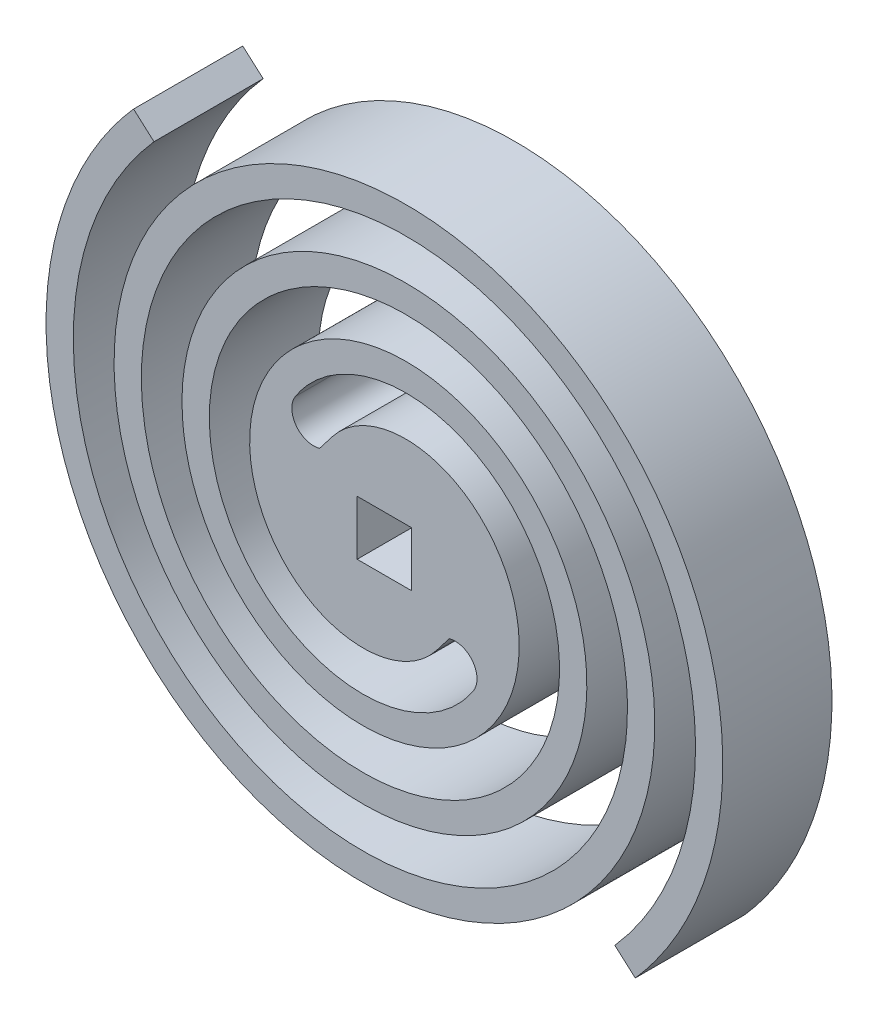
from build123d import *

# Parameters (mm, degrees)
BOSS_EXTRUDE1_DEPTH = 12.7
FILLET1_DEPTH       = 12.7
CUT_EXTRUDE2_REACH  = 56.455
SKETCH6_W           = 6.35
SKETCH6_H           = 6.35


with BuildPart() as part:
    # Sketch5 → Boss-Extrude1 (new body)
    with BuildSketch(Plane.XY):
        with BuildLine():
            Line((-7.544575, 5.814207863), (-6.053628459, 7.748875192))
            add(Edge.make_bspline(
                [(-6.053628459, 7.748875192), (-5.494603872, 8.474271157), (-4.81378454, 9.143172779), (-2.87941615, 10.549007168), (-1.506573664, 11.178645833), (1.506573664, 11.840104167), (3.145692963, 11.870626383), (5.60336479, 11.389593386), (6.421912552, 11.142281181), (8.020309271, 10.472031225), (8.800100547, 10.049082873), (10.28294371, 9.033961384), (10.98593582, 8.441790238), (12.278324098, 7.102891267), (12.867661134, 6.356178392), (13.898861197, 4.730878175), (14.340668532, 3.852318514), (15.047642909, 1.993380088), (15.312760417, 1.013040912), (15.643489583, -1.013040912), (15.709060383, -2.058733463), (15.625496849, -4.174097497), (15.476332528, -5.243710299), (14.956836698, -7.36212114), (14.58648784, -8.41085429), (13.627614614, -10.441206258), (13.039086783, -11.422756714), (11.65661755, -13.272947619), (10.862687224, -14.141519209), (9.091833005, -15.722530756), (8.114934742, -16.434904446), (6.009671569, -17.664911675), (4.881346208, -18.182484606), (2.512881825, -18.990809998), (1.272794992, -19.281510417), (-1.272794992, -19.612239583), (-2.5782352, -19.652227472), (-5.203125191, -19.467312923), (-6.522503693, -19.242383006), (-9.12087749, -18.524080009), (-10.399796028, -18.030694498), (-12.862103244, -16.783198003), (-14.04541288, -16.029090692), (-16.262951528, -14.279273717), (-17.297102598, -13.283584211), (-19.166737415, -11.080774743), (-20.002147757, -9.873691093), (-21.430962152, -7.288464963), (-22.024300681, -5.910373902), (-22.933977087, -3.032383562), (-23.250260417, -1.532549072), (-23.580989583, 1.532549072), (-23.59539456, 3.097736937), (-23.309128998, 6.232152885), (-23.008433483, 7.801297088), (-22.091323321, 10.879633841), (-21.474901157, 12.388737766), (-19.938781392, 15.283000231), (-19.019094601, 16.668069047), (-16.901929883, 19.252955438), (-15.704481197, 20.452685987), (-13.069716481, 22.610944074), (-11.632447443, 23.569391069), (-8.567258357, 25.19701263), (-6.939401595, 25.866116755), (-3.5518853, 26.877144175), (-1.792303153, 27.219010417), (1.792303153, 27.549739583), (3.617238674, 27.538561649), (7.261180579, 27.150945072), (9.080090482, 26.774483961), (12.638390191, 25.658566633), (14.377679504, 24.919107816), (17.703897217, 23.094364781), (19.290725213, 22.009098511), (22.242959347, 19.524586049), (23.608269376, 18.125378184), (26.055150732, 15.058658219), (27.136634381, 13.391203793), (28.963063108, 9.846051751), (29.70793283, 7.968429289), (30.820311264, 4.071387037), (31.187760417, 2.052057233), (31.518489583, -2.052057233), (31.481728738, -4.136740411), (30.992761147, -8.290208272), (30.540534438, -10.358883876), (29.225809944, -14.397146541), (28.363314474, -16.366621242), (26.24994817, -20.124794204), (24.99910242, -21.913381379), (22.147242216, -25.232963256), (20.54627517, -26.763852765), (17.047599957, -29.499357391), (15.149960144, -30.703877692), (11.124845146, -32.729113585), (8.997456983, -33.549748904), (4.590888774, -34.763478353), (2.311811313, -35.156510417), (-2.311811313, -35.487239583), (-4.656242149, -35.424895827), (-9.319235966, -34.834577221), (-11.63767727, -34.306584916), (-16.155902891, -32.793053256), (-18.35556298, -31.807521133), (-22.54569119, -29.405531559), (-24.536037546, -27.989106329), (-28.222967166, -24.769898382), (-29.919436154, -22.967172157), (-32.943564049, -19.036541695), (-34.271121004, -16.908716494), (-36.495164063, -12.40363854), (-37.391564979, -10.026484677), (-38.706645442, -5.110390511), (-39.125260417, -2.571565393), (-39.455989583, 2.571565393), (-39.368062915, 5.175743886), (-38.676393296, 10.34826366), (-38.072635394, 12.916470664), (-36.360296568, 17.914659242), (-35.251727791, 20.344504718), (-32.561114948, 24.966588177), (-30.979110238, 27.158693712), (-29.185832393, 29.185832393)],
                knots=[0.009721649, 0.009721649, 0.009721649, 0.009721649, 0.03125, 0.03125, 0.0625, 0.0625, 0.09375, 0.09375, 0.109375, 0.109375, 0.125, 0.125, 0.140625, 0.140625, 0.15625, 0.15625, 0.171875, 0.171875, 0.1875, 0.1875, 0.203125, 0.203125, 0.21875, 0.21875, 0.234375, 0.234375, 0.25, 0.25, 0.265625, 0.265625, 0.28125, 0.28125, 0.296875, 0.296875, 0.3125, 0.3125, 0.328125, 0.328125, 0.34375, 0.34375, 0.359375, 0.359375, 0.375, 0.375, 0.390625, 0.390625, 0.40625, 0.40625, 0.421875, 0.421875, 0.4375, 0.4375, 0.453125, 0.453125, 0.46875, 0.46875, 0.484375, 0.484375, 0.5, 0.5, 0.515625, 0.515625, 0.53125, 0.53125, 0.546875, 0.546875, 0.5625, 0.5625, 0.578125, 0.578125, 0.59375, 0.59375, 0.609375, 0.609375, 0.625, 0.625, 0.640625, 0.640625, 0.65625, 0.65625, 0.671875, 0.671875, 0.6875, 0.6875, 0.703125, 0.703125, 0.71875, 0.71875, 0.734375, 0.734375, 0.75, 0.75, 0.765625, 0.765625, 0.78125, 0.78125, 0.796875, 0.796875, 0.8125, 0.8125, 0.828125, 0.828125, 0.84375, 0.84375, 0.859375, 0.859375, 0.875, 0.875, 0.890625, 0.890625, 0.90625, 0.90625, 0.921875, 0.921875, 0.9375, 0.9375, 0.953125, 0.953125, 0.96875, 0.96875, 0.984375, 0.984375, 1, 1, 1, 1], degree=3))
            Line((-29.185832393, 29.185832393), (-26.807791467, 27.082134138))
            add(Edge.make_bspline(
                [(4.601695641, 8.339665594), (5.067405868, 8.225077862), (5.534113419, 8.071718691), (6.593192013, 7.627619067), (7.184489663, 7.307383565), (8.311501092, 6.535856576), (8.850953576, 6.081968761), (9.844524359, 5.05264118), (10.301756809, 4.473931069), (11.102914847, 3.211205843), (11.449216067, 2.523388912), (12.003832404, 1.065065027), (12.213701403, 0.290385126), (12.475495439, -1.313392807), (12.528102661, -2.146863055), (12.461403362, -3.835318421), (12.341891986, -4.69469826), (11.924011349, -6.398740562), (11.624569498, -7.247645298), (10.84765878, -8.892703439), (10.368302315, -9.692780107), (9.240582183, -11.202034333), (8.589599617, -11.914664171), (7.135881658, -13.212537736), (6.32990717, -13.800630961), (4.59135496, -14.816386052), (3.655051891, -15.246187791), (1.6881638, -15.917460536), (0.653518602, -16.160283699), (-1.471649795, -16.436390683), (-2.566405083, -16.470192292), (-4.768725351, -16.31504634), (-5.880526276, -16.125768451), (-8.070900266, -15.520254262), (-9.153546431, -15.102858897), (-11.238509111, -14.046539191), (-12.244576927, -13.405678502), (-14.130253158, -11.917727759), (-15.013145914, -11.068005365), (-16.609394724, -9.187300127), (-17.325442262, -8.153096699), (-18.5500084, -5.937427269), (-19.060523695, -4.752282292), (-19.843010218, -2.27668917), (-20.116209143, -0.982250454), (-20.401686956, 1.663471797), (-20.414380716, 3.01889954), (-20.166461403, 5.73344976), (-19.905438423, 7.096707125), (-19.108655184, 9.771159148), (-18.571680414, 11.086317745), (-17.233047743, 13.608487162), (-16.42942206, 14.819136901), (-14.579077094, 17.078258018), (-13.529717083, 18.129902678), (-11.220582937, 20.021421648), (-9.957601183, 20.863881804), (-7.264053684, 22.294160936), (-5.829840973, 22.883879944), (-2.845403139, 23.774605838), (-1.291235704, 24.076755661), (1.874632573, 24.368850493), (3.490416266, 24.359139779), (6.716324625, 24.015990633), (8.330513096, 23.682087438), (11.487796789, 22.691932625), (13.034778603, 22.034428265), (15.992625565, 20.41177121), (17.40704944, 19.444629341), (20.037894141, 17.23058867), (21.257408492, 15.981044175), (23.442371081, 13.242591663), (24.410328871, 11.750486499), (26.044469825, 8.578570697), (26.712482872, 6.895137525), (27.709644714, 3.401738416), (28.039874717, 1.587866668), (28.336893559, -2.097926569), (28.303975181, -3.973884546), (27.864065527, -7.710636517), (27.456569546, -9.575440522), (26.27171541, -13.21479785), (25.493076927, -14.993179084), (23.585299744, -18.385755475), (22.454156937, -20.003448365), (19.875574607, -23.004933206), (18.425486916, -24.391757875), (15.257126895, -26.868999391), (13.535666759, -27.961867509), (9.885047433, -29.798675971), (7.952285815, -30.544392555), (3.949832389, -31.646814068), (1.876264247, -32.004553018), (-2.329324144, -32.305380066), (-4.465343701, -32.248721692), (-8.712612173, -31.711032452), (-10.827828081, -31.229466652), (-14.948764913, -29.849020237), (-16.958266879, -28.948838786), (-20.784945103, -26.755196794), (-22.605570402, -25.459721652), (-25.976969681, -22.516016057), (-27.530727858, -20.865136854), (-30.299460269, -17.26645838), (-31.516839312, -15.31548016), (-33.555499835, -11.185917766), (-34.378514869, -9.003748649), (-35.585386094, -4.492167223), (-35.970238888, -2.158903595), (-36.274099593, 2.566398865), (-36.193330097, 4.962405792), (-35.557148264, 9.719970701), (-35.001177459, 12.085459775), (-33.424509041, 16.687636609), (-32.402495051, 18.928066447), (-29.922458757, 23.18840987), (-28.462431463, 25.211713026), (-26.807791467, 27.082134138)],
                knots=[0.097413737, 0.097413737, 0.097413737, 0.097413737, 0.109375, 0.109375, 0.125, 0.125, 0.140625, 0.140625, 0.15625, 0.15625, 0.171875, 0.171875, 0.1875, 0.1875, 0.203125, 0.203125, 0.21875, 0.21875, 0.234375, 0.234375, 0.25, 0.25, 0.265625, 0.265625, 0.28125, 0.28125, 0.296875, 0.296875, 0.3125, 0.3125, 0.328125, 0.328125, 0.34375, 0.34375, 0.359375, 0.359375, 0.375, 0.375, 0.390625, 0.390625, 0.40625, 0.40625, 0.421875, 0.421875, 0.4375, 0.4375, 0.453125, 0.453125, 0.46875, 0.46875, 0.484375, 0.484375, 0.5, 0.5, 0.515625, 0.515625, 0.53125, 0.53125, 0.546875, 0.546875, 0.5625, 0.5625, 0.578125, 0.578125, 0.59375, 0.59375, 0.609375, 0.609375, 0.625, 0.625, 0.640625, 0.640625, 0.65625, 0.65625, 0.671875, 0.671875, 0.6875, 0.6875, 0.703125, 0.703125, 0.71875, 0.71875, 0.734375, 0.734375, 0.75, 0.75, 0.765625, 0.765625, 0.78125, 0.78125, 0.796875, 0.796875, 0.8125, 0.8125, 0.828125, 0.828125, 0.84375, 0.84375, 0.859375, 0.859375, 0.875, 0.875, 0.890625, 0.890625, 0.90625, 0.90625, 0.921875, 0.921875, 0.9375, 0.9375, 0.953125, 0.953125, 0.96875, 0.96875, 0.984375, 0.984375, 1, 1, 1, 1], degree=3))
            ThreePointArc((4.601695641, 8.339665594), (9.32555661, 1.938973676), (7.544575, -5.814207863))
            Line((7.544575, -5.814207863), (6.053628459, -7.748875192))
            add(Edge.make_bspline(
                [(6.053628459, -7.748875192), (5.494603872, -8.474271157), (4.81378454, -9.143172779), (2.87941615, -10.549007168), (1.506573664, -11.178645833), (-1.506573664, -11.840104167), (-3.145692963, -11.870626383), (-5.60336479, -11.389593386), (-6.421912552, -11.142281181), (-8.020309271, -10.472031225), (-8.800100547, -10.049082873), (-10.28294371, -9.033961384), (-10.98593582, -8.441790238), (-12.278324098, -7.102891267), (-12.867661134, -6.356178392), (-13.898861197, -4.730878175), (-14.340668532, -3.852318514), (-15.047642909, -1.993380088), (-15.312760417, -1.013040912), (-15.643489583, 1.013040912), (-15.709060383, 2.058733463), (-15.625496849, 4.174097497), (-15.476332528, 5.243710299), (-14.956836698, 7.36212114), (-14.58648784, 8.41085429), (-13.627614614, 10.441206258), (-13.039086783, 11.422756714), (-11.65661755, 13.272947619), (-10.862687224, 14.141519209), (-9.091833005, 15.722530756), (-8.114934742, 16.434904446), (-6.009671569, 17.664911675), (-4.881346208, 18.182484606), (-2.512881825, 18.990809998), (-1.272794992, 19.281510417), (1.272794992, 19.612239583), (2.5782352, 19.652227472), (5.203125191, 19.467312923), (6.522503693, 19.242383006), (9.12087749, 18.524080009), (10.399796028, 18.030694498), (12.862103244, 16.783198003), (14.04541288, 16.029090692), (16.262951528, 14.279273717), (17.297102598, 13.283584211), (19.166737415, 11.080774743), (20.002147757, 9.873691093), (21.430962152, 7.288464963), (22.024300681, 5.910373902), (22.933977087, 3.032383562), (23.250260417, 1.532549072), (23.580989583, -1.532549072), (23.59539456, -3.097736937), (23.309128998, -6.232152885), (23.008433483, -7.801297088), (22.091323321, -10.879633841), (21.474901157, -12.388737766), (19.938781392, -15.283000231), (19.019094601, -16.668069047), (16.901929883, -19.252955438), (15.704481197, -20.452685987), (13.069716481, -22.610944074), (11.632447443, -23.569391069), (8.567258357, -25.19701263), (6.939401595, -25.866116755), (3.5518853, -26.877144175), (1.792303153, -27.219010417), (-1.792303153, -27.549739583), (-3.617238674, -27.538561649), (-7.261180579, -27.150945072), (-9.080090482, -26.774483961), (-12.638390191, -25.658566633), (-14.377679504, -24.919107816), (-17.703897217, -23.094364781), (-19.290725213, -22.009098511), (-22.242959347, -19.524586049), (-23.608269376, -18.125378184), (-26.055150732, -15.058658219), (-27.136634381, -13.391203793), (-28.963063108, -9.846051751), (-29.70793283, -7.968429289), (-30.820311264, -4.071387037), (-31.187760417, -2.052057233), (-31.518489583, 2.052057233), (-31.481728738, 4.136740411), (-30.992761147, 8.290208272), (-30.540534438, 10.358883876), (-29.225809944, 14.397146541), (-28.363314474, 16.366621242), (-26.24994817, 20.124794204), (-24.99910242, 21.913381379), (-22.147242216, 25.232963256), (-20.54627517, 26.763852765), (-17.047599957, 29.499357391), (-15.149960144, 30.703877692), (-11.124845146, 32.729113585), (-8.997456983, 33.549748904), (-4.590888774, 34.763478353), (-2.311811313, 35.156510417), (2.311811313, 35.487239583), (4.656242149, 35.424895827), (9.319235966, 34.834577221), (11.63767727, 34.306584916), (16.155902891, 32.793053256), (18.35556298, 31.807521133), (22.54569119, 29.405531559), (24.536037546, 27.989106329), (28.222967166, 24.769898382), (29.919436154, 22.967172157), (32.943564049, 19.036541695), (34.271121004, 16.908716494), (36.495164063, 12.40363854), (37.391564979, 10.026484677), (38.706645442, 5.110390511), (39.125260417, 2.571565393), (39.455989583, -2.571565393), (39.368062915, -5.175743886), (38.676393296, -10.34826366), (38.072635394, -12.916470664), (36.360296568, -17.914659242), (35.251727791, -20.344504718), (32.561114948, -24.966588177), (30.979110238, -27.158693712), (29.185832393, -29.185832393)],
                knots=[0.009721649, 0.009721649, 0.009721649, 0.009721649, 0.03125, 0.03125, 0.0625, 0.0625, 0.09375, 0.09375, 0.109375, 0.109375, 0.125, 0.125, 0.140625, 0.140625, 0.15625, 0.15625, 0.171875, 0.171875, 0.1875, 0.1875, 0.203125, 0.203125, 0.21875, 0.21875, 0.234375, 0.234375, 0.25, 0.25, 0.265625, 0.265625, 0.28125, 0.28125, 0.296875, 0.296875, 0.3125, 0.3125, 0.328125, 0.328125, 0.34375, 0.34375, 0.359375, 0.359375, 0.375, 0.375, 0.390625, 0.390625, 0.40625, 0.40625, 0.421875, 0.421875, 0.4375, 0.4375, 0.453125, 0.453125, 0.46875, 0.46875, 0.484375, 0.484375, 0.5, 0.5, 0.515625, 0.515625, 0.53125, 0.53125, 0.546875, 0.546875, 0.5625, 0.5625, 0.578125, 0.578125, 0.59375, 0.59375, 0.609375, 0.609375, 0.625, 0.625, 0.640625, 0.640625, 0.65625, 0.65625, 0.671875, 0.671875, 0.6875, 0.6875, 0.703125, 0.703125, 0.71875, 0.71875, 0.734375, 0.734375, 0.75, 0.75, 0.765625, 0.765625, 0.78125, 0.78125, 0.796875, 0.796875, 0.8125, 0.8125, 0.828125, 0.828125, 0.84375, 0.84375, 0.859375, 0.859375, 0.875, 0.875, 0.890625, 0.890625, 0.90625, 0.90625, 0.921875, 0.921875, 0.9375, 0.9375, 0.953125, 0.953125, 0.96875, 0.96875, 0.984375, 0.984375, 1, 1, 1, 1], degree=3))
            Line((29.185832393, -29.185832393), (26.807791467, -27.082134138))
            add(Edge.make_bspline(
                [(-4.601695641, -8.339665594), (-5.067405868, -8.225077862), (-5.534113419, -8.071718691), (-6.593192013, -7.627619067), (-7.184489663, -7.307383565), (-8.311501092, -6.535856576), (-8.850953576, -6.081968761), (-9.844524359, -5.05264118), (-10.301756809, -4.473931069), (-11.102914847, -3.211205843), (-11.449216067, -2.523388912), (-12.003832404, -1.065065027), (-12.213701403, -0.290385126), (-12.475495439, 1.313392807), (-12.528102661, 2.146863055), (-12.461403362, 3.835318421), (-12.341891986, 4.69469826), (-11.924011349, 6.398740562), (-11.624569498, 7.247645298), (-10.84765878, 8.892703439), (-10.368302315, 9.692780107), (-9.240582183, 11.202034333), (-8.589599617, 11.914664171), (-7.135881658, 13.212537736), (-6.32990717, 13.800630961), (-4.59135496, 14.816386052), (-3.655051891, 15.246187791), (-1.6881638, 15.917460536), (-0.653518602, 16.160283699), (1.471649795, 16.436390683), (2.566405083, 16.470192292), (4.768725351, 16.31504634), (5.880526276, 16.125768451), (8.070900266, 15.520254262), (9.153546431, 15.102858897), (11.238509111, 14.046539191), (12.244576927, 13.405678502), (14.130253158, 11.917727759), (15.013145914, 11.068005365), (16.609394724, 9.187300127), (17.325442262, 8.153096699), (18.5500084, 5.937427269), (19.060523695, 4.752282292), (19.843010218, 2.27668917), (20.116209143, 0.982250454), (20.401686956, -1.663471797), (20.414380716, -3.01889954), (20.166461403, -5.73344976), (19.905438423, -7.096707125), (19.108655184, -9.771159148), (18.571680414, -11.086317745), (17.233047743, -13.608487162), (16.42942206, -14.819136901), (14.579077094, -17.078258018), (13.529717083, -18.129902678), (11.220582937, -20.021421648), (9.957601183, -20.863881804), (7.264053684, -22.294160936), (5.829840973, -22.883879944), (2.845403139, -23.774605838), (1.291235704, -24.076755661), (-1.874632573, -24.368850493), (-3.490416266, -24.359139779), (-6.716324625, -24.015990633), (-8.330513096, -23.682087438), (-11.487796789, -22.691932625), (-13.034778603, -22.034428265), (-15.992625565, -20.41177121), (-17.40704944, -19.444629341), (-20.037894141, -17.23058867), (-21.257408492, -15.981044175), (-23.442371081, -13.242591663), (-24.410328871, -11.750486499), (-26.044469825, -8.578570697), (-26.712482872, -6.895137525), (-27.709644714, -3.401738416), (-28.039874717, -1.587866668), (-28.336893559, 2.097926569), (-28.303975181, 3.973884546), (-27.864065527, 7.710636517), (-27.456569546, 9.575440522), (-26.27171541, 13.21479785), (-25.493076927, 14.993179084), (-23.585299744, 18.385755475), (-22.454156937, 20.003448365), (-19.875574607, 23.004933206), (-18.425486916, 24.391757875), (-15.257126895, 26.868999391), (-13.535666759, 27.961867509), (-9.885047433, 29.798675971), (-7.952285815, 30.544392555), (-3.949832389, 31.646814068), (-1.876264247, 32.004553018), (2.329324144, 32.305380066), (4.465343701, 32.248721692), (8.712612173, 31.711032452), (10.827828081, 31.229466652), (14.948764913, 29.849020237), (16.958266879, 28.948838786), (20.784945103, 26.755196794), (22.605570402, 25.459721652), (25.976969681, 22.516016057), (27.530727858, 20.865136854), (30.299460269, 17.26645838), (31.516839312, 15.31548016), (33.555499835, 11.185917766), (34.378514869, 9.003748649), (35.585386094, 4.492167223), (35.970238888, 2.158903595), (36.274099593, -2.566398865), (36.193330097, -4.962405792), (35.557148264, -9.719970701), (35.001177459, -12.085459775), (33.424509041, -16.687636609), (32.402495051, -18.928066447), (29.922458757, -23.18840987), (28.462431463, -25.211713026), (26.807791467, -27.082134138)],
                knots=[0.097413737, 0.097413737, 0.097413737, 0.097413737, 0.109375, 0.109375, 0.125, 0.125, 0.140625, 0.140625, 0.15625, 0.15625, 0.171875, 0.171875, 0.1875, 0.1875, 0.203125, 0.203125, 0.21875, 0.21875, 0.234375, 0.234375, 0.25, 0.25, 0.265625, 0.265625, 0.28125, 0.28125, 0.296875, 0.296875, 0.3125, 0.3125, 0.328125, 0.328125, 0.34375, 0.34375, 0.359375, 0.359375, 0.375, 0.375, 0.390625, 0.390625, 0.40625, 0.40625, 0.421875, 0.421875, 0.4375, 0.4375, 0.453125, 0.453125, 0.46875, 0.46875, 0.484375, 0.484375, 0.5, 0.5, 0.515625, 0.515625, 0.53125, 0.53125, 0.546875, 0.546875, 0.5625, 0.5625, 0.578125, 0.578125, 0.59375, 0.59375, 0.609375, 0.609375, 0.625, 0.625, 0.640625, 0.640625, 0.65625, 0.65625, 0.671875, 0.671875, 0.6875, 0.6875, 0.703125, 0.703125, 0.71875, 0.71875, 0.734375, 0.734375, 0.75, 0.75, 0.765625, 0.765625, 0.78125, 0.78125, 0.796875, 0.796875, 0.8125, 0.8125, 0.828125, 0.828125, 0.84375, 0.84375, 0.859375, 0.859375, 0.875, 0.875, 0.890625, 0.890625, 0.90625, 0.90625, 0.921875, 0.921875, 0.9375, 0.9375, 0.953125, 0.953125, 0.96875, 0.96875, 0.984375, 0.984375, 1, 1, 1, 1], degree=3))
            ThreePointArc((-4.601695641, -8.339665594), (-9.32555661, -1.938973676), (-7.544575, 5.814207863))
        make_face()
    extrude(amount=BOSS_EXTRUDE1_DEPTH)

    # Fillet1: read off the stored shape, not the designer's step
    # Fillet1 outline → Fillet1 (add)
    with BuildSketch(Plane.XY):
        with BuildLine():
            ThreePointArc((-4.601695641, -8.339665594), (-9.32555661, -1.938973676), (-7.544575, 5.814207863))
            ThreePointArc((-7.544575, 5.814207863), (-10.274420558, 6.748056028), (-10.370118413, 9.631625186))
            add(Edge.make_bspline(
                [(-4.601695641, -8.339665594), (-5.067405868, -8.225077862), (-5.534113419, -8.071718691), (-6.593192013, -7.627619067), (-7.184489663, -7.307383565), (-8.311501092, -6.535856576), (-8.850953576, -6.081968761), (-9.844524359, -5.05264118), (-10.301756809, -4.473931069), (-11.102914847, -3.211205843), (-11.449216067, -2.523388912), (-12.003832404, -1.065065027), (-12.213701403, -0.290385126), (-12.475495439, 1.313392807), (-12.528102661, 2.146863055), (-12.461403362, 3.835318421), (-12.341891986, 4.69469826), (-11.924011349, 6.398740562), (-11.624569498, 7.247645298), (-10.984891427, 8.602122193), (-10.695649362, 9.124679309), (-10.370118413, 9.631625186)],
                knots=[0.097413737, 0.097413737, 0.097413737, 0.097413737, 0.109375, 0.109375, 0.125, 0.125, 0.140625, 0.140625, 0.15625, 0.15625, 0.171875, 0.171875, 0.1875, 0.1875, 0.203125, 0.203125, 0.21875, 0.21875, 0.234375, 0.234375, 0.244480035, 0.244480035, 0.244480035, 0.244480035], degree=3))
        make_face()
        with BuildLine():
            ThreePointArc((4.601695641, 8.339665594), (9.32555661, 1.938973676), (7.544575, -5.814207863))
            ThreePointArc((7.544575, -5.814207863), (10.274420558, -6.748056028), (10.370118413, -9.631625186))
            add(Edge.make_bspline(
                [(4.601695641, 8.339665594), (5.067405868, 8.225077862), (5.534113419, 8.071718691), (6.593192013, 7.627619067), (7.184489663, 7.307383565), (8.311501092, 6.535856576), (8.850953576, 6.081968761), (9.844524359, 5.05264118), (10.301756809, 4.473931069), (11.102914847, 3.211205843), (11.449216067, 2.523388912), (12.003832404, 1.065065027), (12.213701403, 0.290385126), (12.475495439, -1.313392807), (12.528102661, -2.146863055), (12.461403362, -3.835318421), (12.341891986, -4.69469826), (11.924011349, -6.398740562), (11.624569498, -7.247645298), (10.984891427, -8.602122193), (10.695649362, -9.124679309), (10.370118413, -9.631625186)],
                knots=[0.097413737, 0.097413737, 0.097413737, 0.097413737, 0.109375, 0.109375, 0.125, 0.125, 0.140625, 0.140625, 0.15625, 0.15625, 0.171875, 0.171875, 0.1875, 0.1875, 0.203125, 0.203125, 0.21875, 0.21875, 0.234375, 0.234375, 0.244480035, 0.244480035, 0.244480035, 0.244480035], degree=3))
        make_face()
    extrude(amount=FILLET1_DEPTH)

    # Sketch6 → Cut-Extrude2 (cut, up to next)
    with BuildSketch(Plane.XY.offset(12.7), mode=Mode.PRIVATE) as cut_extrude2_sk1:
        Rectangle(SKETCH6_W, SKETCH6_H)
    cut_extrude2_tool1 = extrude(cut_extrude2_sk1.sketch, amount=-CUT_EXTRUDE2_REACH, mode=Mode.PRIVATE) & part.part
    add(cut_extrude2_tool1.solids().sort_by_distance((0, 0, 12.7))[0], mode=Mode.SUBTRACT)


solid = part.part
